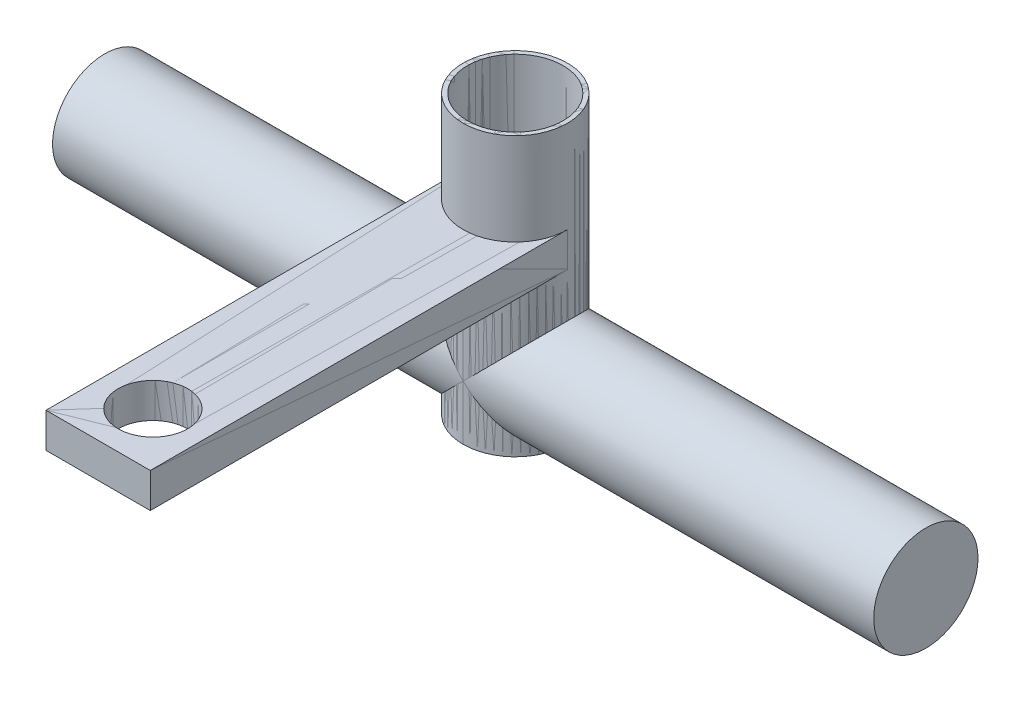
from build123d import *

# Parameters (mm, degrees)
SKETCH1_R          = 9.525
SLEEVE_DEPTH       = 50.8
SKETCH2_W          = 19.05
SKETCH2_H          = 6.35
BRACKET_DEPTH      = 76.2
SKETCH4_R          = 6.35
BRACKET_HOLE_DEPTH = 93.075
SKETCH5_R          = 9.525
SHAFT_DEPTH        = 75
SKETCH6_R          = 8.73125
SLEEVE_HOLE_DEPTH  = 119.372631972


with BuildPart() as part:
    # Sketch1 → Sleeve (new body)
    with BuildSketch(Plane(origin=(0, 0, 0), x_dir=(1, 0, 0), z_dir=(0, 1, 0))):
        Circle(SKETCH1_R)
    extrude(amount=SLEEVE_DEPTH)

    # Sketch2 → Bracket (add)
    with BuildSketch(Plane.XY):
        with Locations((0, 30.8)):
            Rectangle(SKETCH2_W, SKETCH2_H)
    extrude(amount=BRACKET_DEPTH)

    # Sketch4 → Bracket Hole (cut, through all)
    with BuildSketch(Plane(origin=(0, 0, 0), x_dir=(1, 0, 0), z_dir=(0, 1, 0))):
        with Locations((0, -66.2)):
            Circle(SKETCH4_R)
    extrude(amount=BRACKET_HOLE_DEPTH, mode=Mode.SUBTRACT)

    # Sketch5 → Shaft (add)
    with BuildSketch(Plane(origin=(0, 0, 0), x_dir=(0, 0, -1), z_dir=(1, 0, 0))):
        with Locations((0, 10)):
            Circle(SKETCH5_R)
    extrude(amount=SHAFT_DEPTH)

    # Sketch6 → Sleeve Hole (cut, through all)
    with BuildSketch(Plane(origin=(0, 0, 0), x_dir=(1, 0, 0), z_dir=(0, 1, 0))):
        Circle(SKETCH6_R)
    extrude(amount=SLEEVE_HOLE_DEPTH, mode=Mode.SUBTRACT)


with BuildPart() as body_2:
    # Mirror1: mirrored copy
    add(part.part.mirror(Plane(origin=(0, 0, 0), x_dir=(0, 0, 1), z_dir=(1, 0, 0))))


solid = Compound([part.part, body_2.part])
